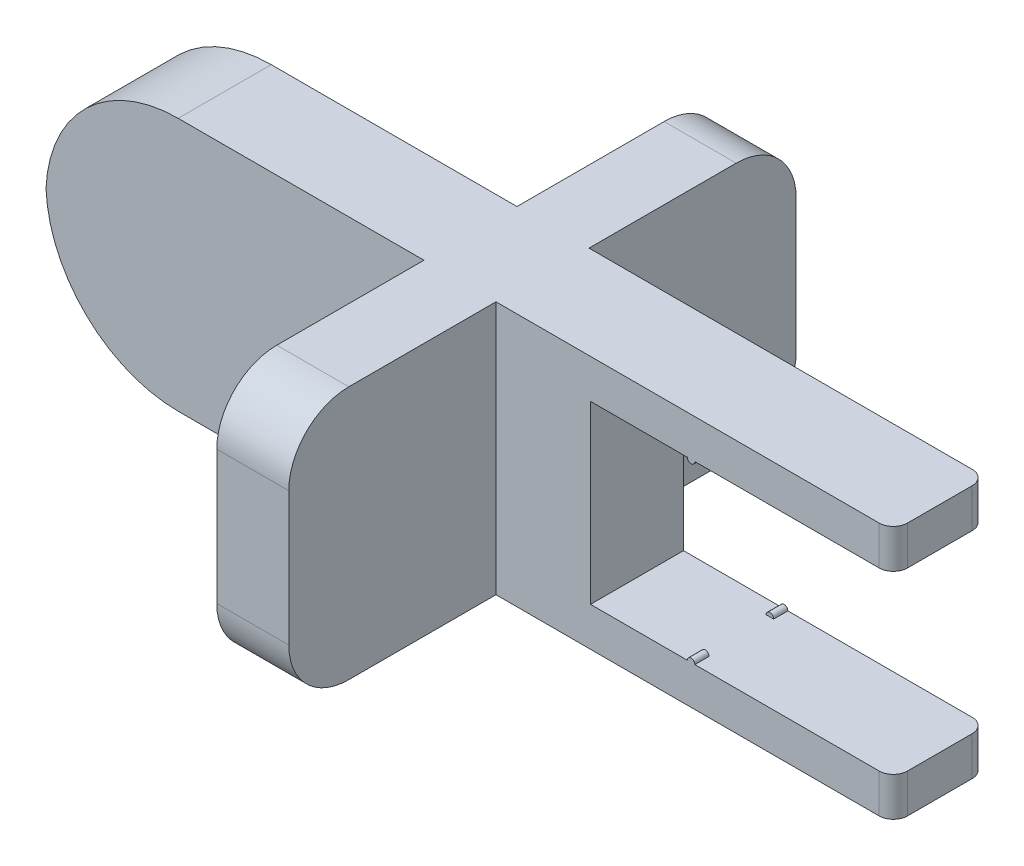
from build123d import *

# Parameters (mm, degrees)
BOSS_EXTRUDE1_DEPTH = 4.92
CUT_EXTRUDE1_REACH  = 27.419
CUT_EXTRUDE2_REACH  = 24.607
SKETCH3_W           = 3.42
SKETCH3_H           = 9.3
BOSS_EXTRUDE2_DEPTH = 3.81
SKETCH5_W           = 4.92
SKETCH5_H           = 13.42
BOSS_EXTRUDE3_DEPTH = 20
FILLET1_R           = 7


with BuildPart() as part:
    # Sketch1 → Boss-Extrude1 (new body)
    with BuildSketch(Plane.XY):
        with BuildLine():
            Line((0, -6.71), (0, 6.71))
            Line((0, 6.71), (21.02, 6.71))
            Line((21.02, 6.71), (21.02, 4.65))
            Line((21.02, 4.65), (10.52, 4.65))
            ThreePointArc((10.52, 4.65), (10.32, 4.45), (10.12, 4.65))
            Line((10.12, 4.65), (5, 4.65))
            Line((5, 4.65), (5, -4.65))
            Line((5, -4.65), (10.12, -4.65))
            ThreePointArc((10.12, -4.65), (10.32, -4.45), (10.52, -4.65))
            Line((10.52, -4.65), (21.02, -4.65))
            Line((21.02, -4.65), (21.02, -6.71))
            Line((21.02, -6.71), (0, -6.71))
        make_face()
    extrude(amount=BOSS_EXTRUDE1_DEPTH)

    # Cut-Extrude1: up to this face of the body (flat: up to its plane)
    cut_extrude1_end = Plane(part.part.faces().sort_by_distance((10.51, -6.71, 2.46))[0])
    # Sketch2 → Cut-Extrude1 (cut, up to the picked face)
    with BuildSketch(Plane(origin=(0, 6.71, 0), x_dir=(1, 0, 0), z_dir=(0, 1, 0)), mode=Mode.PRIVATE) as cut_extrude1_sk1:
        with BuildLine():
            Line((18.617685134, -4.92), (20.27, -4.92))
            ThreePointArc((20.27, -4.92), (20.800330086, -4.700330086), (21.02, -4.17))
            Line((21.02, -4.17), (21.02, -0.75))
            ThreePointArc((21.02, -0.75), (20.800330086, -0.219669914), (20.27, 0))
            Line((20.27, 0), (18.617685134, 0))
            Line((18.617685134, 0), (18.617685134, 2.663079407))
            Line((18.617685134, 2.663079407), (23.784387399, 2.663079407))
            Line((23.784387399, 2.663079407), (23.784387399, -9.532215778))
            Line((23.784387399, -9.532215778), (18.617685134, -9.532215778))
            Line((18.617685134, -9.532215778), (18.617685134, -4.92))
        make_face()
    cut_extrude1_tool1 = split(extrude(cut_extrude1_sk1.sketch, amount=-CUT_EXTRUDE1_REACH, mode=Mode.PRIVATE), bisect_by=cut_extrude1_end, keep=Keep.BOTH, mode=Mode.PRIVATE)
    add(cut_extrude1_tool1.solids().sort_by(Axis((21.51704, 6.71, 3.653957), (0, -1, 0)))[0], mode=Mode.SUBTRACT)

    # Cut-Extrude2: up to this face of the body (flat: up to its plane)
    cut_extrude2_end = Plane(part.part.faces().sort_by_distance((5, 0, 2.46))[0])
    # Sketch3 → Cut-Extrude2 (cut, up to the picked face)
    with BuildSketch(Plane(origin=(21.02, 0, 0), x_dir=(0, 0, -1), z_dir=(1, 0, 0)), mode=Mode.PRIVATE) as cut_extrude2_sk1:
        with Locations((-2.46, 0)):
            Rectangle(SKETCH3_W, SKETCH3_H)
    cut_extrude2_tool1 = split(extrude(cut_extrude2_sk1.sketch, amount=-CUT_EXTRUDE2_REACH, mode=Mode.PRIVATE), bisect_by=cut_extrude2_end, keep=Keep.BOTH, mode=Mode.PRIVATE)
    add(cut_extrude2_tool1.solids().sort_by(Axis((21.02, 0, 2.46), (-1, 0, 0)))[0], mode=Mode.SUBTRACT)

    # Sketch4 → Boss-Extrude2 (add)
    with BuildSketch(Plane.ZY):
        with BuildLine():
            Line((12.705, -6.71), (-7.785, -6.71))
            ThreePointArc((-7.785, -6.71), (-10.03006403, -5.78006403), (-10.96, -3.535))
            Line((-10.96, -3.535), (-10.96, 3.535))
            ThreePointArc((-10.96, 3.535), (-10.03006403, 5.78006403), (-7.785, 6.71))
            Line((-7.785, 6.71), (12.705, 6.71))
            ThreePointArc((12.705, 6.71), (14.95006403, 5.78006403), (15.88, 3.535))
            Line((15.88, 3.535), (15.88, -3.535))
            ThreePointArc((15.88, -3.535), (14.95006403, -5.78006403), (12.705, -6.71))
        make_face()
    extrude(amount=BOSS_EXTRUDE2_DEPTH)

    # Sketch5 → Boss-Extrude3 (add)
    with BuildSketch(Plane.ZY.offset(3.81)):
        with Locations((2.46, 0)):
            Rectangle(SKETCH5_W, SKETCH5_H)
    extrude(amount=BOSS_EXTRUDE3_DEPTH)

    # Fillet1
    # the kernel refuses this fillet: 7 mm, written as the material it takes off along each edge
    with BuildSketch(Plane(origin=(-23.81, -6.71, 22.42), x_dir=(1, 0, 0), z_dir=(0, 0, -1)), Plane(origin=(-23.81, 6.71, -17.5), x_dir=(1, 0, 0), z_dir=(0, 0, 1))) as fillet1_piece_1:
        with BuildLine():
            CenterArc((FILLET1_R, -FILLET1_R), FILLET1_R, 90, 90)
            Line((0, -FILLET1_R), (0, 0))
            Line((0, 0), (FILLET1_R, 0))
        make_face()
    extrude(amount=39.92, mode=Mode.SUBTRACT)


solid = part.part
